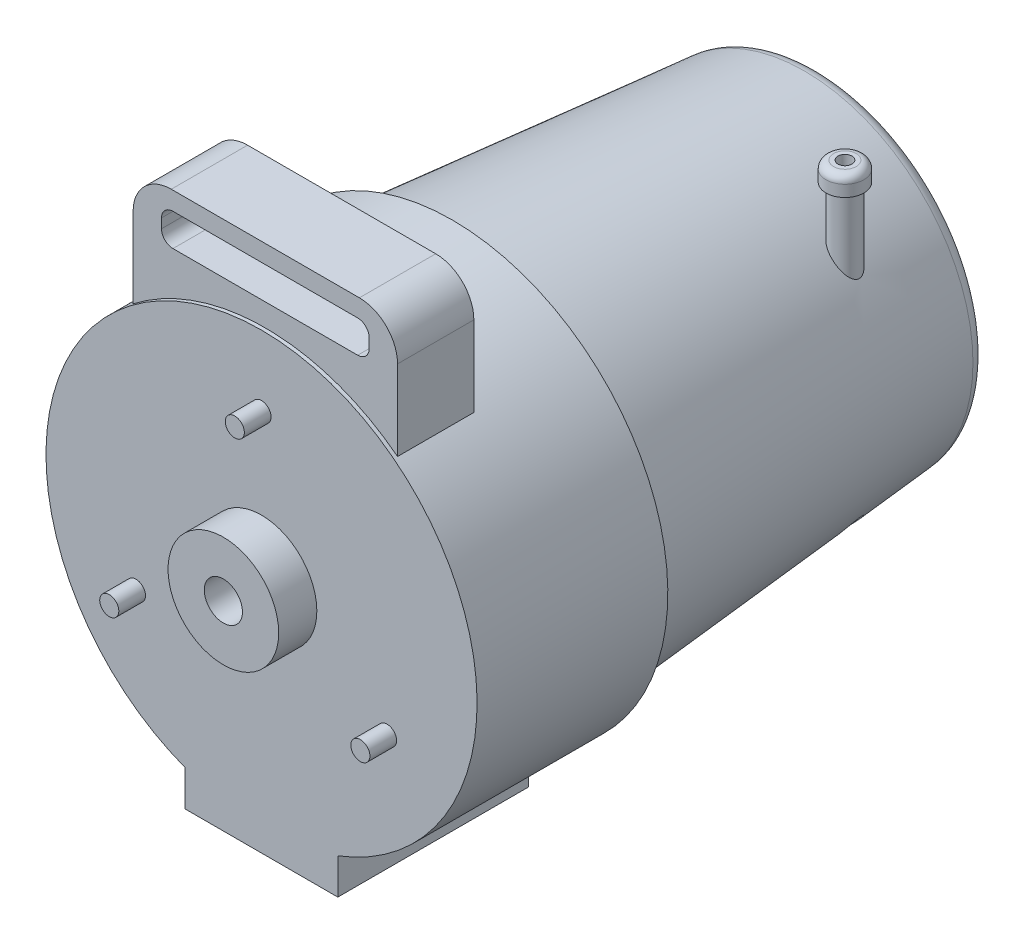
from build123d import *

# Parameters (mm, degrees)
SKETCH1_R                       = 5
BOSS_EXTRUDE1_DEPTH             = 50
BOSS_EXTRUDE2_START             = 10
SKETCH2_R                       = 14.5
SKETCH2_R_2                     = 5
BOSS_EXTRUDE2_DEPTH             = 10
BOSS_EXTRUDE3_START             = -1
BOSS_EXTRUDE3_DEPTH             = 20
SKETCH5_R                       = 2.5
BOSS_EXTRUDE4_DEPTH             = 7
FILLET1_R                       = 1
SKETCH32_R                      = 49.202776882
SKETCH32_R_2                    = 47.352776882
CUT_EXTRUDE16_DEPTH             = 47
BOSS_EXTRUDE10_DEPTH            = 1.85
SKETCH35_R                      = 2.5
BOSS_EXTRUDE11_DEPTH            = 4.98
SKETCH36_R                      = 1.25
BOSS_EXTRUDE12_DEPTH            = 0.94
SKETCH8_W                       = 30.41
SKETCH8_H                       = 10
CUT_EXTRUDE1_DEPTH              = 6.28
CUT_EXTRUDE2_REACH              = 184.349
BOSS_EXTRUDE5_REACH             = 175.871
SKETCH10_W                      = 33.69
SKETCH10_H                      = 31.29
BOSS_EXTRUDE5_DIRECTION_2_REACH = 175.871
CUT_EXTRUDE3_REACH              = 175.871
SKETCH11_R                      = 5
SKETCH28_R                      = 18.21
CUT_EXTRUDE14_DEPTH             = 1.27
BOSS_EXTRUDE8_REACH             = 217.096
BOSS_EXTRUDE8_START             = -15
SKETCH29_R                      = 3.54
SKETCH30_R                      = 4.96
BOSS_EXTRUDE9_DEPTH             = 5
FILLET3_R                       = 2
SKETCH31_R                      = 1.835
CUT_EXTRUDE15_DEPTH             = 25.01
CUT_EXTRUDE17_REACH             = 225.871
CUT_EXTRUDE17_START             = -50
SKETCH37_R                      = 3.54
SKETCH38_R                      = 1.5
CUT_EXTRUDE18_DEPTH             = 182.359236048


with BuildPart() as part:
    # Sketch1 → Boss-Extrude1 (new body)
    with BuildSketch(Plane.XY):
        with BuildLine():
            Line((-20, -52.841744861), (-20, -62.22))
            Line((-20, -62.22), (20, -62.22))
            Line((20, -62.22), (20, -52.841744861))
            ThreePointArc((20, -52.841744861), (0, 56.5), (-20, -52.841744861))
        make_face()
        Circle(SKETCH1_R, mode=Mode.SUBTRACT)
    extrude(amount=-BOSS_EXTRUDE1_DEPTH)

    # Sketch2 → Boss-Extrude2 (add)
    with BuildSketch(Plane.XY.offset(BOSS_EXTRUDE2_START)):
        Circle(SKETCH2_R)
        Circle(SKETCH2_R_2, mode=Mode.SUBTRACT)
    extrude(amount=-BOSS_EXTRUDE2_DEPTH)

    # Sketch3 → Revolve1 (revolve)
    with BuildSketch(Plane(origin=(0, 0, 0), x_dir=(0, 0, -1), z_dir=(1, 0, 0))):
        with BuildLine():
            Line((146, -40.15), (146, 0))
            Line((146, 0), (50, 0))
            Line((50, 0), (50, -52.214236395))
            Line((50, -52.214236395), (142.348622971, -44.134778792))
            ThreePointArc((142.348622971, -44.134778792), (144.949109347, -42.85236083), (146, -40.15))
        make_face()
    revolve(axis=Axis((0, 0, 0), (0, 0, -1)))

    # Sketch4 → Boss-Extrude3 (add)
    with BuildSketch(Plane.XY.offset(BOSS_EXTRUDE3_START)):
        with BuildLine():
            Line((24.655, 75.65), (-24.655, 75.65))
            ThreePointArc((-24.655, 75.65), (-31.726067812, 72.721067812), (-34.655, 65.65))
            Line((-34.655, 65.65), (-34.655, 44.623771412))
            ThreePointArc((-34.655, 44.623771412), (0, 56.5), (34.655, 44.623771412))
            Line((34.655, 44.623771412), (34.655, 65.65))
            ThreePointArc((34.655, 65.65), (31.726067812, 72.721067812), (24.655, 75.65))
        make_face()
        with BuildLine():
            ThreePointArc((-27.21, 67.86), (-26.331320344, 69.981320344), (-24.21, 70.86))
            Line((-24.21, 70.86), (24.21, 70.86))
            ThreePointArc((24.21, 70.86), (26.331320344, 69.981320344), (27.21, 67.86))
            Line((27.21, 67.86), (27.21, 65.4))
            ThreePointArc((27.21, 65.4), (26.331320344, 63.278679656), (24.21, 62.4))
            Line((24.21, 62.4), (-24.21, 62.4))
            ThreePointArc((-24.21, 62.4), (-26.331320344, 63.278679656), (-27.21, 65.4))
            Line((-27.21, 65.4), (-27.21, 67.86))
        make_face(mode=Mode.SUBTRACT)
    extrude(amount=-BOSS_EXTRUDE3_DEPTH)

    # Sketch5 → Boss-Extrude4 (add)
    with BuildSketch(Plane.XY):
        with Locations((0, 38)):
            Circle(SKETCH5_R)
        with Locations((32.908965344, -19)):
            Circle(SKETCH5_R)
        with Locations((-32.908965344, -19)):
            Circle(SKETCH5_R)
    extrude(amount=BOSS_EXTRUDE4_DEPTH)

    # Sketch6 → Cut-Revolve1 (revolve, cut)
    with BuildSketch(Plane(origin=(0, 0, 0), x_dir=(0, 0, -1), z_dir=(1, 0, 0)), mode=Mode.PRIVATE) as cut_revolve1_sk:
        Polygon((143, 0), (3, 0), (3, -47.352776882), (50, -47.352776882), (50, -49.202776882), (143, -41.066331174), (143, -3.5), (146, -3.5), (146, 0), align=None)
    revolve(cut_revolve1_sk.sketch.rotate(Axis((0, 0, -146), (0, 0, 1)), 180), axis=Axis((0, 0, -146), (0, 0, 1)), mode=Mode.SUBTRACT)

    # Fillet1
    fillet1_edges = [part.edges().sort_by_distance(p)[0] for p in [
        (0, -3.5, -146),
    ]]
    fillet(fillet1_edges, radius=FILLET1_R)

    # Sketch32 → Cut-Extrude16 (cut)
    with BuildSketch(Plane(origin=(0, 0, -50), x_dir=(-1, 0, 0), z_dir=(0, 0, -1))):
        with Locations(Location((0, 0, 0), (0, 0, 90))):
            Circle(SKETCH32_R)
        Circle(SKETCH32_R_2, mode=Mode.SUBTRACT)
    extrude(amount=-CUT_EXTRUDE16_DEPTH, mode=Mode.SUBTRACT)

    # Sketch33 → Boss-Extrude10 (add)
    with BuildSketch(Plane(origin=(0, -47.35, 0), x_dir=(-1, 0, 0), z_dir=(0, -1, 0))):
        Polygon((-20, 3), (20, 3), (20, 14.82), (13.355, 40), (-13.355, 40), (-20, 14.82), align=None)
    extrude(amount=-BOSS_EXTRUDE10_DEPTH)

    # Sketch35 → Boss-Extrude11 (add)
    with BuildSketch(Plane(origin=(0, -45.5, 0), x_dir=(1, 0, 0), z_dir=(0, 1, 0))):
        with Locations(Location((0, 35.17, 0), (0, 0, 270))):
            Circle(SKETCH35_R)
    extrude(amount=BOSS_EXTRUDE11_DEPTH)

    # Sketch36 → Boss-Extrude12 (add)
    with BuildSketch(Plane(origin=(0, -40.52, 0), x_dir=(1, 0, 0), z_dir=(0, 1, 0))):
        with Locations(Location((0, 35.17, 0), (0, 0, 270))):
            Circle(SKETCH36_R)
    extrude(amount=BOSS_EXTRUDE12_DEPTH)

    # Sketch8 → Cut-Extrude1 (cut, symmetric)
    with BuildSketch(Plane(origin=(0, 0, 0), x_dir=(0, 0, -1), z_dir=(1, 0, 0))):
        with Locations((25, -57.22)):
            Rectangle(SKETCH8_W, SKETCH8_H)
    extrude(amount=CUT_EXTRUDE1_DEPTH, both=True, mode=Mode.SUBTRACT)

    # Sketch9 → Cut-Extrude2 (cut, up to next)
    with BuildSketch(Plane(origin=(0, 0, -146), x_dir=(-1, 0, 0), z_dir=(0, 0, -1)), mode=Mode.PRIVATE) as cut_extrude2_sk1:
        with BuildLine():
            Line((-1.97, 40.101640864), (-1.97, 31.63))
            ThreePointArc((-1.97, 31.63), (0, 29.66), (1.97, 31.63))
            Line((1.97, 31.63), (1.97, 40.101640864))
            ThreePointArc((1.97, 40.101640864), (0, 40.15), (-1.97, 40.101640864))
        make_face()
    cut_extrude2_tool1 = extrude(cut_extrude2_sk1.sketch, amount=-CUT_EXTRUDE2_REACH, mode=Mode.PRIVATE) & part.part
    # Sketch9 → Cut-Extrude2 (cut, up to next)
    with BuildSketch(Plane(origin=(0, 0, -146), x_dir=(-1, 0, 0), z_dir=(0, 0, -1)), mode=Mode.PRIVATE) as cut_extrude2_sk2:
        with BuildLine():
            Line((8.476194518, 39.245084106), (6.283572519, 31.062107404))
            ThreePointArc((6.283572519, 31.062107404), (7.676572878, 28.649360008), (10.089320274, 30.042360367))
            Line((10.089320274, 30.042360367), (12.281942273, 38.225337068))
            ThreePointArc((12.281942273, 38.225337068), (10.391584661, 38.781921926), (8.476194518, 39.245084106))
        make_face()
    cut_extrude2_tool2 = extrude(cut_extrude2_sk2.sketch, amount=-CUT_EXTRUDE2_REACH, mode=Mode.PRIVATE) & part.part
    # Sketch9 → Cut-Extrude2 (cut, up to next)
    with BuildSketch(Plane(origin=(0, 0, -146), x_dir=(-1, 0, 0), z_dir=(0, 0, -1)), mode=Mode.PRIVATE) as cut_extrude2_sk3:
        with BuildLine():
            Line((18.344750387, 35.714039722), (14.108929955, 28.377383522))
            ThreePointArc((14.108929955, 28.377383522), (14.83, 25.686313476), (17.521070045, 26.407383522))
            Line((17.521070045, 26.407383522), (21.756890478, 33.744039722))
            ThreePointArc((21.756890478, 33.744039722), (20.075, 34.770919962), (18.344750387, 35.714039722))
        make_face()
    cut_extrude2_tool3 = extrude(cut_extrude2_sk3.sketch, amount=-CUT_EXTRUDE2_REACH, mode=Mode.PRIVATE) & part.part
    # Sketch9 → Cut-Extrude2 (cut, up to next)
    with BuildSketch(Plane(origin=(0, 0, -146), x_dir=(-1, 0, 0), z_dir=(0, 0, -1)), mode=Mode.PRIVATE) as cut_extrude2_sk4:
        with BuildLine():
            Line((26.963141833, 29.749142551), (20.97278713, 23.758787848))
            ThreePointArc((20.97278713, 23.758787848), (20.97278713, 20.97278713), (23.758787848, 20.97278713))
            Line((23.758787848, 20.97278713), (29.749142551, 26.963141833))
            ThreePointArc((29.749142551, 26.963141833), (28.390337265, 28.390337265), (26.963141833, 29.749142551))
        make_face()
    cut_extrude2_tool4 = extrude(cut_extrude2_sk4.sketch, amount=-CUT_EXTRUDE2_REACH, mode=Mode.PRIVATE) & part.part
    # Sketch9 → Cut-Extrude2 (cut, up to next)
    with BuildSketch(Plane(origin=(0, 0, -146), x_dir=(-1, 0, 0), z_dir=(0, 0, -1)), mode=Mode.PRIVATE) as cut_extrude2_sk5:
        with BuildLine():
            Line((33.744039722, 21.756890478), (26.407383522, 17.521070045))
            ThreePointArc((26.407383522, 17.521070045), (25.686313476, 14.83), (28.377383522, 14.108929955))
            Line((28.377383522, 14.108929955), (35.714039722, 18.344750387))
            ThreePointArc((35.714039722, 18.344750387), (34.770919962, 20.075), (33.744039722, 21.756890478))
        make_face()
    cut_extrude2_tool5 = extrude(cut_extrude2_sk5.sketch, amount=-CUT_EXTRUDE2_REACH, mode=Mode.PRIVATE) & part.part
    # Sketch9 → Cut-Extrude2 (cut, up to next)
    with BuildSketch(Plane(origin=(0, 0, -146), x_dir=(-1, 0, 0), z_dir=(0, 0, -1)), mode=Mode.PRIVATE) as cut_extrude2_sk6:
        with BuildLine():
            Line((38.225337068, 12.281942273), (30.042360367, 10.089320274))
            ThreePointArc((30.042360367, 10.089320274), (28.649360008, 7.676572878), (31.062107404, 6.283572519))
            Line((31.062107404, 6.283572519), (39.245084106, 8.476194518))
            ThreePointArc((39.245084106, 8.476194518), (38.781921926, 10.391584661), (38.225337068, 12.281942273))
        make_face()
    cut_extrude2_tool6 = extrude(cut_extrude2_sk6.sketch, amount=-CUT_EXTRUDE2_REACH, mode=Mode.PRIVATE) & part.part
    # Sketch9 → Cut-Extrude2 (cut, up to next)
    with BuildSketch(Plane(origin=(0, 0, -146), x_dir=(-1, 0, 0), z_dir=(0, 0, -1)), mode=Mode.PRIVATE) as cut_extrude2_sk7:
        with BuildLine():
            Line((40.101640864, 1.97), (31.63, 1.97))
            ThreePointArc((31.63, 1.97), (29.66, 0), (31.63, -1.97))
            Line((31.63, -1.97), (40.101640864, -1.97))
            ThreePointArc((40.101640864, -1.97), (40.15, 0), (40.101640864, 1.97))
        make_face()
    cut_extrude2_tool7 = extrude(cut_extrude2_sk7.sketch, amount=-CUT_EXTRUDE2_REACH, mode=Mode.PRIVATE) & part.part
    # Sketch9 → Cut-Extrude2 (cut, up to next)
    with BuildSketch(Plane(origin=(0, 0, -146), x_dir=(-1, 0, 0), z_dir=(0, 0, -1)), mode=Mode.PRIVATE) as cut_extrude2_sk8:
        with BuildLine():
            Line((39.245084106, -8.476194518), (31.062107404, -6.283572519))
            ThreePointArc((31.062107404, -6.283572519), (28.649360008, -7.676572878), (30.042360367, -10.089320274))
            Line((30.042360367, -10.089320274), (38.225337068, -12.281942273))
            ThreePointArc((38.225337068, -12.281942273), (38.781921926, -10.391584661), (39.245084106, -8.476194518))
        make_face()
    cut_extrude2_tool8 = extrude(cut_extrude2_sk8.sketch, amount=-CUT_EXTRUDE2_REACH, mode=Mode.PRIVATE) & part.part
    # Sketch9 → Cut-Extrude2 (cut, up to next)
    with BuildSketch(Plane(origin=(0, 0, -146), x_dir=(-1, 0, 0), z_dir=(0, 0, -1)), mode=Mode.PRIVATE) as cut_extrude2_sk9:
        with BuildLine():
            Line((35.714039722, -18.344750387), (28.377383522, -14.108929955))
            ThreePointArc((28.377383522, -14.108929955), (25.686313476, -14.83), (26.407383522, -17.521070045))
            Line((26.407383522, -17.521070045), (33.744039722, -21.756890478))
            ThreePointArc((33.744039722, -21.756890478), (34.770919962, -20.075), (35.714039722, -18.344750387))
        make_face()
    cut_extrude2_tool9 = extrude(cut_extrude2_sk9.sketch, amount=-CUT_EXTRUDE2_REACH, mode=Mode.PRIVATE) & part.part
    # Sketch9 → Cut-Extrude2 (cut, up to next)
    with BuildSketch(Plane(origin=(0, 0, -146), x_dir=(-1, 0, 0), z_dir=(0, 0, -1)), mode=Mode.PRIVATE) as cut_extrude2_sk10:
        with BuildLine():
            Line((29.749142551, -26.963141833), (23.758787848, -20.97278713))
            ThreePointArc((23.758787848, -20.97278713), (20.97278713, -20.97278713), (20.97278713, -23.758787848))
            Line((20.97278713, -23.758787848), (26.963141833, -29.749142551))
            ThreePointArc((26.963141833, -29.749142551), (28.390337265, -28.390337265), (29.749142551, -26.963141833))
        make_face()
    cut_extrude2_tool10 = extrude(cut_extrude2_sk10.sketch, amount=-CUT_EXTRUDE2_REACH, mode=Mode.PRIVATE) & part.part
    # Sketch9 → Cut-Extrude2 (cut, up to next)
    with BuildSketch(Plane(origin=(0, 0, -146), x_dir=(-1, 0, 0), z_dir=(0, 0, -1)), mode=Mode.PRIVATE) as cut_extrude2_sk11:
        with BuildLine():
            Line((21.756890478, -33.744039722), (17.521070045, -26.407383522))
            ThreePointArc((17.521070045, -26.407383522), (14.83, -25.686313476), (14.108929955, -28.377383522))
            Line((14.108929955, -28.377383522), (18.344750387, -35.714039722))
            ThreePointArc((18.344750387, -35.714039722), (20.075, -34.770919962), (21.756890478, -33.744039722))
        make_face()
    cut_extrude2_tool11 = extrude(cut_extrude2_sk11.sketch, amount=-CUT_EXTRUDE2_REACH, mode=Mode.PRIVATE) & part.part
    # Sketch9 → Cut-Extrude2 (cut, up to next)
    with BuildSketch(Plane(origin=(0, 0, -146), x_dir=(-1, 0, 0), z_dir=(0, 0, -1)), mode=Mode.PRIVATE) as cut_extrude2_sk12:
        with BuildLine():
            Line((12.281942273, -38.225337068), (10.089320274, -30.042360367))
            ThreePointArc((10.089320274, -30.042360367), (7.676572878, -28.649360008), (6.283572519, -31.062107404))
            Line((6.283572519, -31.062107404), (8.476194518, -39.245084106))
            ThreePointArc((8.476194518, -39.245084106), (10.391584661, -38.781921926), (12.281942273, -38.225337068))
        make_face()
    cut_extrude2_tool12 = extrude(cut_extrude2_sk12.sketch, amount=-CUT_EXTRUDE2_REACH, mode=Mode.PRIVATE) & part.part
    # Sketch9 → Cut-Extrude2 (cut, up to next)
    with BuildSketch(Plane(origin=(0, 0, -146), x_dir=(-1, 0, 0), z_dir=(0, 0, -1)), mode=Mode.PRIVATE) as cut_extrude2_sk13:
        with BuildLine():
            Line((1.97, -40.101640864), (1.97, -31.63))
            ThreePointArc((1.97, -31.63), (0, -29.66), (-1.97, -31.63))
            Line((-1.97, -31.63), (-1.97, -40.101640864))
            ThreePointArc((-1.97, -40.101640864), (0, -40.15), (1.97, -40.101640864))
        make_face()
    cut_extrude2_tool13 = extrude(cut_extrude2_sk13.sketch, amount=-CUT_EXTRUDE2_REACH, mode=Mode.PRIVATE) & part.part
    # Sketch9 → Cut-Extrude2 (cut, up to next)
    with BuildSketch(Plane(origin=(0, 0, -146), x_dir=(-1, 0, 0), z_dir=(0, 0, -1)), mode=Mode.PRIVATE) as cut_extrude2_sk14:
        with BuildLine():
            Line((-8.476194518, -39.245084106), (-6.283572519, -31.062107404))
            ThreePointArc((-6.283572519, -31.062107404), (-7.676572878, -28.649360008), (-10.089320274, -30.042360367))
            Line((-10.089320274, -30.042360367), (-12.281942273, -38.225337068))
            ThreePointArc((-12.281942273, -38.225337068), (-10.391584661, -38.781921926), (-8.476194518, -39.245084106))
        make_face()
    cut_extrude2_tool14 = extrude(cut_extrude2_sk14.sketch, amount=-CUT_EXTRUDE2_REACH, mode=Mode.PRIVATE) & part.part
    # Sketch9 → Cut-Extrude2 (cut, up to next)
    with BuildSketch(Plane(origin=(0, 0, -146), x_dir=(-1, 0, 0), z_dir=(0, 0, -1)), mode=Mode.PRIVATE) as cut_extrude2_sk15:
        with BuildLine():
            Line((-18.344750387, -35.714039722), (-14.108929955, -28.377383522))
            ThreePointArc((-14.108929955, -28.377383522), (-14.83, -25.686313476), (-17.521070045, -26.407383522))
            Line((-17.521070045, -26.407383522), (-21.756890478, -33.744039722))
            ThreePointArc((-21.756890478, -33.744039722), (-20.075, -34.770919962), (-18.344750387, -35.714039722))
        make_face()
    cut_extrude2_tool15 = extrude(cut_extrude2_sk15.sketch, amount=-CUT_EXTRUDE2_REACH, mode=Mode.PRIVATE) & part.part
    # Sketch9 → Cut-Extrude2 (cut, up to next)
    with BuildSketch(Plane(origin=(0, 0, -146), x_dir=(-1, 0, 0), z_dir=(0, 0, -1)), mode=Mode.PRIVATE) as cut_extrude2_sk16:
        with BuildLine():
            Line((-26.963141833, -29.749142551), (-20.97278713, -23.758787848))
            ThreePointArc((-20.97278713, -23.758787848), (-20.97278713, -20.97278713), (-23.758787848, -20.97278713))
            Line((-23.758787848, -20.97278713), (-29.749142551, -26.963141833))
            ThreePointArc((-29.749142551, -26.963141833), (-28.390337265, -28.390337265), (-26.963141833, -29.749142551))
        make_face()
    cut_extrude2_tool16 = extrude(cut_extrude2_sk16.sketch, amount=-CUT_EXTRUDE2_REACH, mode=Mode.PRIVATE) & part.part
    # Sketch9 → Cut-Extrude2 (cut, up to next)
    with BuildSketch(Plane(origin=(0, 0, -146), x_dir=(-1, 0, 0), z_dir=(0, 0, -1)), mode=Mode.PRIVATE) as cut_extrude2_sk17:
        with BuildLine():
            Line((-33.744039722, -21.756890478), (-26.407383522, -17.521070045))
            ThreePointArc((-26.407383522, -17.521070045), (-25.686313476, -14.83), (-28.377383522, -14.108929955))
            Line((-28.377383522, -14.108929955), (-35.714039722, -18.344750387))
            ThreePointArc((-35.714039722, -18.344750387), (-34.770919962, -20.075), (-33.744039722, -21.756890478))
        make_face()
    cut_extrude2_tool17 = extrude(cut_extrude2_sk17.sketch, amount=-CUT_EXTRUDE2_REACH, mode=Mode.PRIVATE) & part.part
    # Sketch9 → Cut-Extrude2 (cut, up to next)
    with BuildSketch(Plane(origin=(0, 0, -146), x_dir=(-1, 0, 0), z_dir=(0, 0, -1)), mode=Mode.PRIVATE) as cut_extrude2_sk18:
        with BuildLine():
            Line((-38.225337068, -12.281942273), (-30.042360367, -10.089320274))
            ThreePointArc((-30.042360367, -10.089320274), (-28.649360008, -7.676572878), (-31.062107404, -6.283572519))
            Line((-31.062107404, -6.283572519), (-39.245084106, -8.476194518))
            ThreePointArc((-39.245084106, -8.476194518), (-38.781921926, -10.391584661), (-38.225337068, -12.281942273))
        make_face()
    cut_extrude2_tool18 = extrude(cut_extrude2_sk18.sketch, amount=-CUT_EXTRUDE2_REACH, mode=Mode.PRIVATE) & part.part
    # Sketch9 → Cut-Extrude2 (cut, up to next)
    with BuildSketch(Plane(origin=(0, 0, -146), x_dir=(-1, 0, 0), z_dir=(0, 0, -1)), mode=Mode.PRIVATE) as cut_extrude2_sk19:
        with BuildLine():
            Line((-40.101640864, -1.97), (-31.63, -1.97))
            ThreePointArc((-31.63, -1.97), (-29.66, 0), (-31.63, 1.97))
            Line((-31.63, 1.97), (-40.101640864, 1.97))
            ThreePointArc((-40.101640864, 1.97), (-40.15, 0), (-40.101640864, -1.97))
        make_face()
    cut_extrude2_tool19 = extrude(cut_extrude2_sk19.sketch, amount=-CUT_EXTRUDE2_REACH, mode=Mode.PRIVATE) & part.part
    # Sketch9 → Cut-Extrude2 (cut, up to next)
    with BuildSketch(Plane(origin=(0, 0, -146), x_dir=(-1, 0, 0), z_dir=(0, 0, -1)), mode=Mode.PRIVATE) as cut_extrude2_sk20:
        with BuildLine():
            Line((-39.245084106, 8.476194518), (-31.062107404, 6.283572519))
            ThreePointArc((-31.062107404, 6.283572519), (-28.649360008, 7.676572878), (-30.042360367, 10.089320274))
            Line((-30.042360367, 10.089320274), (-38.225337068, 12.281942273))
            ThreePointArc((-38.225337068, 12.281942273), (-38.781921926, 10.391584661), (-39.245084106, 8.476194518))
        make_face()
    cut_extrude2_tool20 = extrude(cut_extrude2_sk20.sketch, amount=-CUT_EXTRUDE2_REACH, mode=Mode.PRIVATE) & part.part
    # Sketch9 → Cut-Extrude2 (cut, up to next)
    with BuildSketch(Plane(origin=(0, 0, -146), x_dir=(-1, 0, 0), z_dir=(0, 0, -1)), mode=Mode.PRIVATE) as cut_extrude2_sk21:
        with BuildLine():
            Line((-35.714039722, 18.344750387), (-28.377383522, 14.108929955))
            ThreePointArc((-28.377383522, 14.108929955), (-25.686313476, 14.83), (-26.407383522, 17.521070045))
            Line((-26.407383522, 17.521070045), (-33.744039722, 21.756890478))
            ThreePointArc((-33.744039722, 21.756890478), (-34.770919962, 20.075), (-35.714039722, 18.344750387))
        make_face()
    cut_extrude2_tool21 = extrude(cut_extrude2_sk21.sketch, amount=-CUT_EXTRUDE2_REACH, mode=Mode.PRIVATE) & part.part
    # Sketch9 → Cut-Extrude2 (cut, up to next)
    with BuildSketch(Plane(origin=(0, 0, -146), x_dir=(-1, 0, 0), z_dir=(0, 0, -1)), mode=Mode.PRIVATE) as cut_extrude2_sk22:
        with BuildLine():
            Line((-29.749142551, 26.963141833), (-23.758787848, 20.97278713))
            ThreePointArc((-23.758787848, 20.97278713), (-20.97278713, 20.97278713), (-20.97278713, 23.758787848))
            Line((-20.97278713, 23.758787848), (-26.963141833, 29.749142551))
            ThreePointArc((-26.963141833, 29.749142551), (-28.390337265, 28.390337265), (-29.749142551, 26.963141833))
        make_face()
    cut_extrude2_tool22 = extrude(cut_extrude2_sk22.sketch, amount=-CUT_EXTRUDE2_REACH, mode=Mode.PRIVATE) & part.part
    # Sketch9 → Cut-Extrude2 (cut, up to next)
    with BuildSketch(Plane(origin=(0, 0, -146), x_dir=(-1, 0, 0), z_dir=(0, 0, -1)), mode=Mode.PRIVATE) as cut_extrude2_sk23:
        with BuildLine():
            Line((-21.756890478, 33.744039722), (-17.521070045, 26.407383522))
            ThreePointArc((-17.521070045, 26.407383522), (-14.83, 25.686313476), (-14.108929955, 28.377383522))
            Line((-14.108929955, 28.377383522), (-18.344750387, 35.714039722))
            ThreePointArc((-18.344750387, 35.714039722), (-20.075, 34.770919962), (-21.756890478, 33.744039722))
        make_face()
    cut_extrude2_tool23 = extrude(cut_extrude2_sk23.sketch, amount=-CUT_EXTRUDE2_REACH, mode=Mode.PRIVATE) & part.part
    # Sketch9 → Cut-Extrude2 (cut, up to next)
    with BuildSketch(Plane(origin=(0, 0, -146), x_dir=(-1, 0, 0), z_dir=(0, 0, -1)), mode=Mode.PRIVATE) as cut_extrude2_sk24:
        with BuildLine():
            Line((-12.281942273, 38.225337068), (-10.089320274, 30.042360367))
            ThreePointArc((-10.089320274, 30.042360367), (-7.676572878, 28.649360008), (-6.283572519, 31.062107404))
            Line((-6.283572519, 31.062107404), (-8.476194518, 39.245084106))
            ThreePointArc((-8.476194518, 39.245084106), (-10.391584661, 38.781921926), (-12.281942273, 38.225337068))
        make_face()
    cut_extrude2_tool24 = extrude(cut_extrude2_sk24.sketch, amount=-CUT_EXTRUDE2_REACH, mode=Mode.PRIVATE) & part.part
    add(cut_extrude2_tool1.solids().sort_by_distance((0, 35.098718, -146))[0], mode=Mode.SUBTRACT)
    add(cut_extrude2_tool2.solids().sort_by_distance((-9.084217, 33.902758, -146))[0], mode=Mode.SUBTRACT)
    add(cut_extrude2_tool3.solids().sort_by_distance((-17.549359, 30.396381, -146))[0], mode=Mode.SUBTRACT)
    add(cut_extrude2_tool4.solids().sort_by_distance((-24.818541, 24.818541, -146))[0], mode=Mode.SUBTRACT)
    add(cut_extrude2_tool5.solids().sort_by_distance((-30.396381, 17.549359, -146))[0], mode=Mode.SUBTRACT)
    add(cut_extrude2_tool6.solids().sort_by_distance((-33.902758, 9.084217, -146))[0], mode=Mode.SUBTRACT)
    add(cut_extrude2_tool7.solids().sort_by_distance((-35.098718, 0, -146))[0], mode=Mode.SUBTRACT)
    add(cut_extrude2_tool8.solids().sort_by_distance((-33.902758, -9.084217, -146))[0], mode=Mode.SUBTRACT)
    add(cut_extrude2_tool9.solids().sort_by_distance((-30.396381, -17.549359, -146))[0], mode=Mode.SUBTRACT)
    add(cut_extrude2_tool10.solids().sort_by_distance((-24.818541, -24.818541, -146))[0], mode=Mode.SUBTRACT)
    add(cut_extrude2_tool11.solids().sort_by_distance((-17.549359, -30.396381, -146))[0], mode=Mode.SUBTRACT)
    add(cut_extrude2_tool12.solids().sort_by_distance((-9.084217, -33.902758, -146))[0], mode=Mode.SUBTRACT)
    add(cut_extrude2_tool13.solids().sort_by_distance((0, -35.098718, -146))[0], mode=Mode.SUBTRACT)
    add(cut_extrude2_tool14.solids().sort_by_distance((9.084217, -33.902758, -146))[0], mode=Mode.SUBTRACT)
    add(cut_extrude2_tool15.solids().sort_by_distance((17.549359, -30.396381, -146))[0], mode=Mode.SUBTRACT)
    add(cut_extrude2_tool16.solids().sort_by_distance((24.818541, -24.818541, -146))[0], mode=Mode.SUBTRACT)
    add(cut_extrude2_tool17.solids().sort_by_distance((30.396381, -17.549359, -146))[0], mode=Mode.SUBTRACT)
    add(cut_extrude2_tool18.solids().sort_by_distance((33.902758, -9.084217, -146))[0], mode=Mode.SUBTRACT)
    add(cut_extrude2_tool19.solids().sort_by_distance((35.098718, 0, -146))[0], mode=Mode.SUBTRACT)
    add(cut_extrude2_tool20.solids().sort_by_distance((33.902758, 9.084217, -146))[0], mode=Mode.SUBTRACT)
    add(cut_extrude2_tool21.solids().sort_by_distance((30.396381, 17.549359, -146))[0], mode=Mode.SUBTRACT)
    add(cut_extrude2_tool22.solids().sort_by_distance((24.818541, 24.818541, -146))[0], mode=Mode.SUBTRACT)
    add(cut_extrude2_tool23.solids().sort_by_distance((17.549359, 30.396381, -146))[0], mode=Mode.SUBTRACT)
    add(cut_extrude2_tool24.solids().sort_by_distance((9.084217, 33.902758, -146))[0], mode=Mode.SUBTRACT)

    # Boss-Extrude5: up to this cone (the profile starts inside it)
    boss_extrude5_end = Plane(origin=(0, 0, -119.155), z_dir=(0, 0, 1)) * Cone(23.946680872, 62.358315839, 439.046996712, mode=Mode.PRIVATE)
    # Sketch10 → Boss-Extrude5 (add, up to the surface)
    with BuildSketch(Plane(origin=(0, 0, 0), x_dir=(0, 0, -1), z_dir=(1, 0, 0)), mode=Mode.PRIVATE) as boss_extrude5_sk1:
        with Locations((119.155, 0)):
            Rectangle(SKETCH10_W, SKETCH10_H)
    boss_extrude5_tool1 = extrude(boss_extrude5_sk1.sketch, amount=BOSS_EXTRUDE5_REACH, mode=Mode.PRIVATE) & boss_extrude5_end
    add(boss_extrude5_tool1.solids().sort_by_distance((0, 0, -119.155))[0])

    # Boss-Extrude5 direction 2: up to this cone (the profile starts inside it)
    boss_extrude5_direction_2_end = Plane(origin=(0, 0, -119.155), z_dir=(0, 0, 1)) * Cone(23.946680872, 62.358315839, 439.046996712, mode=Mode.PRIVATE)
    # Sketch10 → Boss-Extrude5 direction 2 (add, up to the surface)
    with BuildSketch(Plane(origin=(0, 0, 0), x_dir=(0, 0, -1), z_dir=(1, 0, 0)), mode=Mode.PRIVATE) as boss_extrude5_direction_2_sk1:
        with Locations((119.155, 0)):
            Rectangle(SKETCH10_W, SKETCH10_H)
    boss_extrude5_direction_2_tool1 = extrude(boss_extrude5_direction_2_sk1.sketch, amount=-BOSS_EXTRUDE5_DIRECTION_2_REACH, mode=Mode.PRIVATE) & boss_extrude5_direction_2_end
    add(boss_extrude5_direction_2_tool1.solids().sort_by_distance((0, 0, -119.155))[0])

    # Cut-Sweep4: sweep along a path in Sketch25
    with BuildLine() as cut_sweep4_path:  # in the path sketch's own coordinates; laid on its plane below (add() does not lay a ready-made edge on the line's plane)
        add(Edge.make_bspline(
            [(41.793967367, 102.31), (40.716566909, 113.843168268), (39.634124725, 125.375871966), (38.545259241, 136.907964241)],
            knots=[0, 0, 0, 0, 1.026951868, 1.026951868, 1.026951868, 1.026951868], degree=3))
    # Sketch24 → Cut-Sweep4 (sweep, cut)
    with BuildSketch(Plane.XY.offset(-102.31)):
        with BuildLine():
            Line((41.793967367, 15.645), (29.088374331, 15.645))
            ThreePointArc((29.088374331, 15.645), (39.319685727, 11.835805512), (44.568823269, 2.263122994))
            ThreePointArc((44.568823269, 2.263122994), (43.696699642, 9.060914612), (41.793967367, 15.645))
        make_face()
    cut_sweep4 = sweep(path=Plane(origin=(0, 15.645, 0), x_dir=(1, 0, 0), z_dir=(0, 1, 0)) * cut_sweep4_path.line, mode=Mode.SUBTRACT)

    # Mirror1: Cut-Sweep4 across plane
    add(cut_sweep4.mirror(Plane.ZX), mode=Mode.SUBTRACT)

    # Mirror2: Cut-Sweep4 across plane
    add(cut_sweep4.mirror(Plane(origin=(0, 0, 0), x_dir=(0, 0, 1), z_dir=(1, 0, 0))), mode=Mode.SUBTRACT)

    # Mirror2 copy 1: sweep along a path in Mirror2 copy 1 path
    with BuildLine() as mirror2_copy_1_path:  # in the path sketch's own coordinates; laid on its plane below (add() does not lay a ready-made edge on the line's plane)
        add(Edge.make_bspline(
            [(41.793967367, 102.31), (40.716566909, 113.843168268), (39.634124725, 125.375871966), (38.545259241, 136.907964241)],
            knots=[0, 0, 0, 0, 1.026951868, 1.026951868, 1.026951868, 1.026951868], degree=3))
    # Mirror2 copy 1 sketch → Mirror2 copy 1 (sweep, cut)
    with BuildSketch(Plane(origin=(0, 0, -102.31), x_dir=(-1, 0, 0), z_dir=(0, 0, 1))):
        with BuildLine():
            Line((41.793967367, 15.645), (29.088374331, 15.645))
            ThreePointArc((29.088374331, 15.645), (39.319685727, 11.835805512), (44.568823269, 2.263122994))
            ThreePointArc((44.568823269, 2.263122994), (43.696699642, 9.060914612), (41.793967367, 15.645))
        make_face()
    sweep(path=Plane(origin=(0, -15.645, 0), x_dir=(-1, 0, 0), z_dir=(0, -1, 0)) * mirror2_copy_1_path.line, mode=Mode.SUBTRACT)

    # Sketch11 → Cut-Extrude3 (cut, up to next)
    with BuildSketch(Plane(origin=(0, 0, -136), x_dir=(-1, 0, 0), z_dir=(0, 0, -1)), mode=Mode.PRIVATE) as cut_extrude3_sk1:
        with Locations(Location((0, 0, 0), (0, 0, 180))):
            Circle(SKETCH11_R)
    cut_extrude3_tool1 = extrude(cut_extrude3_sk1.sketch, amount=-CUT_EXTRUDE3_REACH, mode=Mode.PRIVATE) & part.part
    add(cut_extrude3_tool1.solids().sort_by_distance((0, 0, -136))[0], mode=Mode.SUBTRACT)

    # Sketch28 → Cut-Extrude14 (cut)
    with BuildSketch(Plane.XY.offset(-102.31)):
        Circle(SKETCH28_R)
    extrude(amount=-CUT_EXTRUDE14_DEPTH, mode=Mode.SUBTRACT)

    # Boss-Extrude8: up to this cone (the profile starts outside it)
    boss_extrude8_end = Plane(origin=(0, 0, -119.155), z_dir=(0, 0, 1)) * Cone(23.087951663, 69.239964074, 527.519915737, mode=Mode.PRIVATE)
    # Sketch29 → Boss-Extrude8 (add, up to the surface)
    with BuildSketch(Plane(origin=(0, 62.4, 0), x_dir=(1, 0, 0), z_dir=(0, 1, 0)).offset(BOSS_EXTRUDE8_START), mode=Mode.PRIVATE) as boss_extrude8_sk1:
        with Locations(Location((33.77, 119.155, 0), (0, 0, 270))):
            Circle(SKETCH29_R)
    boss_extrude8_tool1 = extrude(boss_extrude8_sk1.sketch, amount=-BOSS_EXTRUDE8_REACH, mode=Mode.PRIVATE) - boss_extrude8_end
    add(boss_extrude8_tool1.solids().sort_by_distance((33.77, 47.4, -119.155))[0])

    # Sketch30 → Boss-Extrude9 (add)
    with BuildSketch(Plane(origin=(0, 47.4, 0), x_dir=(1, 0, 0), z_dir=(0, 1, 0))):
        with Locations(Location((33.77, 119.155, 0), (0, 0, 270))):
            Circle(SKETCH30_R)
    extrude(amount=BOSS_EXTRUDE9_DEPTH)

    # Fillet3
    fillet3_edges = [part.edges().sort_by_distance(p)[0] for p in [
        (33.77, 52.4, -124.115),
    ]]
    fillet(fillet3_edges, radius=FILLET3_R)

    # Sketch31 → Cut-Extrude15 (cut)
    with BuildSketch(Plane(origin=(0, 52.4, 0), x_dir=(1, 0, 0), z_dir=(0, 1, 0))):
        with Locations(Location((33.77, 119.155, 0), (0, 0, 270))):
            Circle(SKETCH31_R)
    extrude(amount=-CUT_EXTRUDE15_DEPTH, mode=Mode.SUBTRACT)

    # Cut-Extrude17: up to this cone (the profile starts outside it)
    cut_extrude17_end = Plane(origin=(0, 0, -119.155), z_dir=(0, 0, 1)) * Cone(19.572247696, 66.732749016, 539.046996712, mode=Mode.PRIVATE)
    # Sketch37 → Cut-Extrude17 (cut, up to the surface)
    with BuildSketch(Plane(origin=(0, 0, 0), x_dir=(1, 0, 0), z_dir=(0, 1, 0)).offset(CUT_EXTRUDE17_START), mode=Mode.PRIVATE) as cut_extrude17_sk1:
        with Locations(Location((33.77, 119.155, 0), (0, 0, 270))):
            Circle(SKETCH37_R)
    cut_extrude17_tool1 = extrude(cut_extrude17_sk1.sketch, amount=CUT_EXTRUDE17_REACH, mode=Mode.PRIVATE) - cut_extrude17_end
    add(cut_extrude17_tool1.solids().sort_by_distance((33.77, -50, -119.155))[0], mode=Mode.SUBTRACT)

    # Sketch38 → Cut-Extrude18 (cut, through all)
    with BuildSketch(Plane.ZY.offset(20)):
        with Locations((-23.36, -55.98)):
            Circle(SKETCH38_R)
    extrude(amount=-CUT_EXTRUDE18_DEPTH, mode=Mode.SUBTRACT)


solid = part.part
